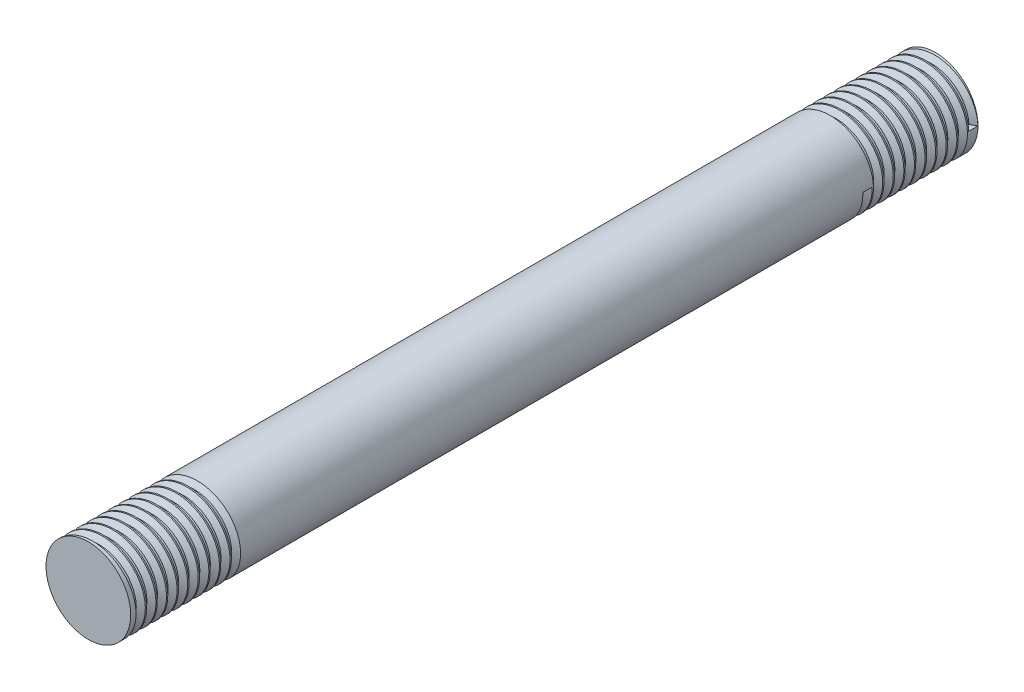
from build123d import *

# Parameters (mm, degrees)
SKETCH1_R           = 4
BOSS_EXTRUDE1_DEPTH = 80
THREAD1_PITCH       = 1
THREAD2_PITCH       = 1


with BuildPart() as part:
    # Sketch1 → Boss-Extrude1 (new body)
    with BuildSketch(Plane.XY):
        Circle(SKETCH1_R)
    extrude(amount=BOSS_EXTRUDE1_DEPTH)

    # Thread1: the profile of Thread Profile1 profile screwed along a right-hand helix of 10 turns, 8 arcs to a turn; built about Z, then put on its axis
    thread1_z = Axis((0, 0, 0), (0, 0, 1))
    thread1_corners = [(4.0003, 0, -0.000173205), (4.0003, 0, 0.875173202), (3.458734125, 0, 0.562499999), (3.458734125, 0, 0.312499999)]
    with BuildLine(mode=Mode.PRIVATE) as thread1_profile:
        Line(thread1_corners[0], thread1_corners[1])
        Line(thread1_corners[1], thread1_corners[2])
        Line(thread1_corners[2], thread1_corners[3])
        Line(thread1_corners[3], thread1_corners[0])
    thread1_cap = Face(thread1_profile.wire())
    thread1_turn_angles = [0, 22.5, 45, 67.5, 90, 112.5, 135, 157.5, 180, 202.5, 225, 247.5, 270, 292.5, 315, 337.5, 360]
    thread1_turn_weights = [1, 0.9238795325112867, 1, 0.9238795325112867, 1, 0.9238795325112867, 1, 0.9238795325112867, 1, 0.9238795325112867, 1, 0.9238795325112867, 1, 0.9238795325112867, 1, 0.9238795325112867, 1]
    thread1_turn_rails = [Edge.make_bspline([Vector(p[0], p[1], 0).rotate(thread1_z, thread1_turn_angles[k]) / thread1_turn_weights[k] + Vector(0, 0, p[2] + THREAD1_PITCH * thread1_turn_angles[k] / 360) for k in range(17)], [0, 0, 0, 1, 1, 2, 2, 3, 3, 4, 4, 5, 5, 6, 6, 7, 7, 8, 8, 8], 2, thread1_turn_weights) for p in thread1_corners]
    thread1_turn_sides = [Face.make_surface_from_curves(thread1_turn_rails[p[0]], thread1_turn_rails[p[1]]) for p in [(0, 1), (1, 2), (2, 3), (3, 0)]]
    thread1 = Plane(origin=(0, 0, 80), x_dir=(-1, 0, 0), z_dir=(0, 0, -1)) * Solid(Shell([*[p.moved(Location((0, 0, THREAD1_PITCH * i))) for i in range(10) for p in thread1_turn_sides], thread1_cap, thread1_cap.rotate(thread1_z, 3600).moved(Location((0, 0, THREAD1_PITCH * 3600 / 360)))]))
    add(thread1, mode=Mode.SUBTRACT)

    # Thread2: the profile of Thread Profile2 profile screwed along a right-hand helix of 10 turns, 8 arcs to a turn; built about Z, then put on its axis
    thread2_z = Axis((0, 0, 0), (0, 0, 1))
    thread2_corners = [(4.0003, 0, -0.000173205), (4.0003, 0, 0.875173202), (3.458734125, 0, 0.562499999), (3.458734125, 0, 0.312499999)]
    with BuildLine(mode=Mode.PRIVATE) as thread2_profile:
        Line(thread2_corners[0], thread2_corners[1])
        Line(thread2_corners[1], thread2_corners[2])
        Line(thread2_corners[2], thread2_corners[3])
        Line(thread2_corners[3], thread2_corners[0])
    thread2_cap = Face(thread2_profile.wire())
    thread2_turn_angles = [0, 22.5, 45, 67.5, 90, 112.5, 135, 157.5, 180, 202.5, 225, 247.5, 270, 292.5, 315, 337.5, 360]
    thread2_turn_weights = [1, 0.9238795325112867, 1, 0.9238795325112867, 1, 0.9238795325112867, 1, 0.9238795325112867, 1, 0.9238795325112867, 1, 0.9238795325112867, 1, 0.9238795325112867, 1, 0.9238795325112867, 1]
    thread2_turn_rails = [Edge.make_bspline([Vector(p[0], p[1], 0).rotate(thread2_z, thread2_turn_angles[k]) / thread2_turn_weights[k] + Vector(0, 0, p[2] + THREAD2_PITCH * thread2_turn_angles[k] / 360) for k in range(17)], [0, 0, 0, 1, 1, 2, 2, 3, 3, 4, 4, 5, 5, 6, 6, 7, 7, 8, 8, 8], 2, thread2_turn_weights) for p in thread2_corners]
    thread2_turn_sides = [Face.make_surface_from_curves(thread2_turn_rails[p[0]], thread2_turn_rails[p[1]]) for p in [(0, 1), (1, 2), (2, 3), (3, 0)]]
    thread2 = Plane(origin=(0, 0, 0), x_dir=(1, 0, 0), z_dir=(0, 0, 1)) * Solid(Shell([*[p.moved(Location((0, 0, THREAD2_PITCH * i))) for i in range(10) for p in thread2_turn_sides], thread2_cap, thread2_cap.rotate(thread2_z, 3600).moved(Location((0, 0, THREAD2_PITCH * 3600 / 360)))]))
    add(thread2, mode=Mode.SUBTRACT)


solid = part.part
